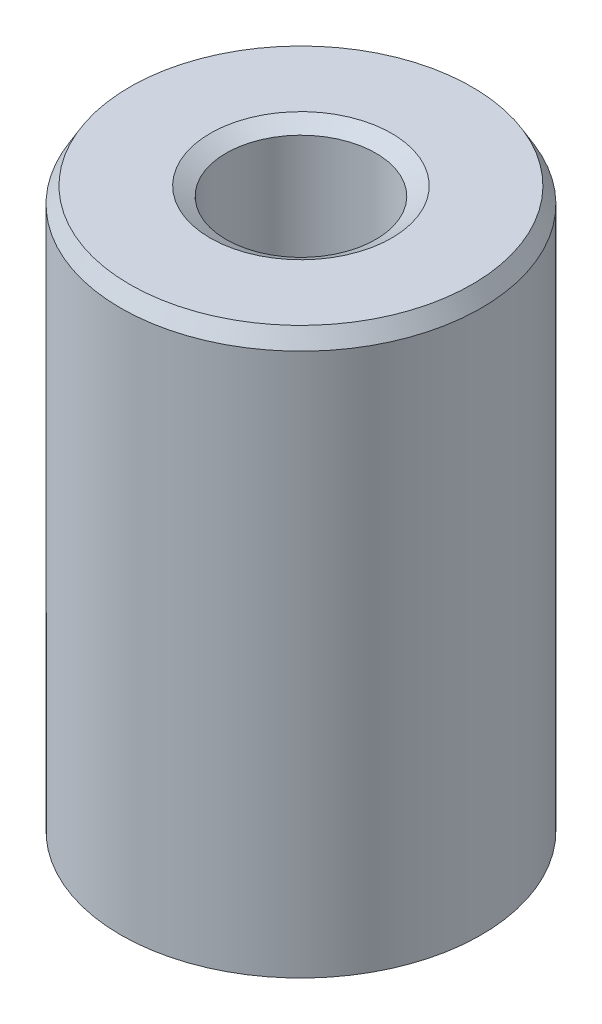
from build123d import *
from OCP.BRepFilletAPI import BRepFilletAPI_MakeChamfer

# Parameters (mm, degrees)
SKETCH1_R           = 12.5
BOSS_EXTRUDE1_DEPTH = 39.376730341
SKETCH2_R           = 5.19035766
CUT_EXTRUDE1_DEPTH  = 44.162795233
CHAMFER1_SIZE       = 1.101400186
CHAMFER1_SIZE2      = 0.635893694


with BuildPart() as part:
    # Sketch1 → Boss-Extrude1 (new body)
    with BuildSketch(Plane(origin=(0, 0, 0), x_dir=(1, 0, 0), z_dir=(0, 1, 0))):
        Circle(SKETCH1_R)
    extrude(amount=BOSS_EXTRUDE1_DEPTH)

    # Sketch2 → Cut-Extrude1 (cut, through all)
    with BuildSketch(Plane(origin=(0, 0, 0), x_dir=(1, 0, 0), z_dir=(0, 1, 0))):
        Circle(SKETCH2_R)
    extrude(amount=CUT_EXTRUDE1_DEPTH, mode=Mode.SUBTRACT)

    # Chamfer1: one chamfer whose edges measure the first distance from different faces: ONE call of the kernel's chamfer builder (chamfer() names one face for all edges)
    chamfer1_edges_1 = [part.edges().sort_by_distance(p)[0] for p in [
        (-5.19035766, 39.376730341, 0),
    ]]
    chamfer1_side_1 = [part.faces().sort_by_distance(p)[0] for p in [
        (-12.146446609, 39.376730341, 0),
    ]]
    chamfer1_edges_2 = [part.edges().sort_by_distance(p)[0] for p in [
        (-5.19035766, 0, 0),
    ]]
    chamfer1_side_2 = [part.faces().sort_by_distance(p)[0] for p in [
        (-5.19035766, 19.68836517, 0),
    ]]
    chamfer1_edges_3 = [part.edges().sort_by_distance(p)[0] for p in [
        (-12.5, 0, 0),
    ]]
    chamfer1_side_3 = [part.faces().sort_by_distance(p)[0] for p in [
        (-12.146446609, 0, 0),
    ]]
    chamfer1_edges_4 = [part.edges().sort_by_distance(p)[0] for p in [
        (-12.5, 39.376730341, 0),
    ]]
    chamfer1_side_4 = [part.faces().sort_by_distance(p)[0] for p in [
        (-12.5, 19.68836517, 0),
    ]]
    chamfer1 = BRepFilletAPI_MakeChamfer(part.part.solid().wrapped)
    for e in chamfer1_edges_1:
        chamfer1.Add(CHAMFER1_SIZE, CHAMFER1_SIZE2, e.wrapped, chamfer1_side_1[0].wrapped)  # the first distance lies on this face
    for e in chamfer1_edges_2:
        chamfer1.Add(CHAMFER1_SIZE, CHAMFER1_SIZE2, e.wrapped, chamfer1_side_2[0].wrapped)  # the first distance lies on this face
    for e in chamfer1_edges_3:
        chamfer1.Add(CHAMFER1_SIZE, CHAMFER1_SIZE2, e.wrapped, chamfer1_side_3[0].wrapped)  # the first distance lies on this face
    for e in chamfer1_edges_4:
        chamfer1.Add(CHAMFER1_SIZE, CHAMFER1_SIZE2, e.wrapped, chamfer1_side_4[0].wrapped)  # the first distance lies on this face
    add(Compound.cast(chamfer1.Shape()), mode=Mode.REPLACE)


solid = part.part
